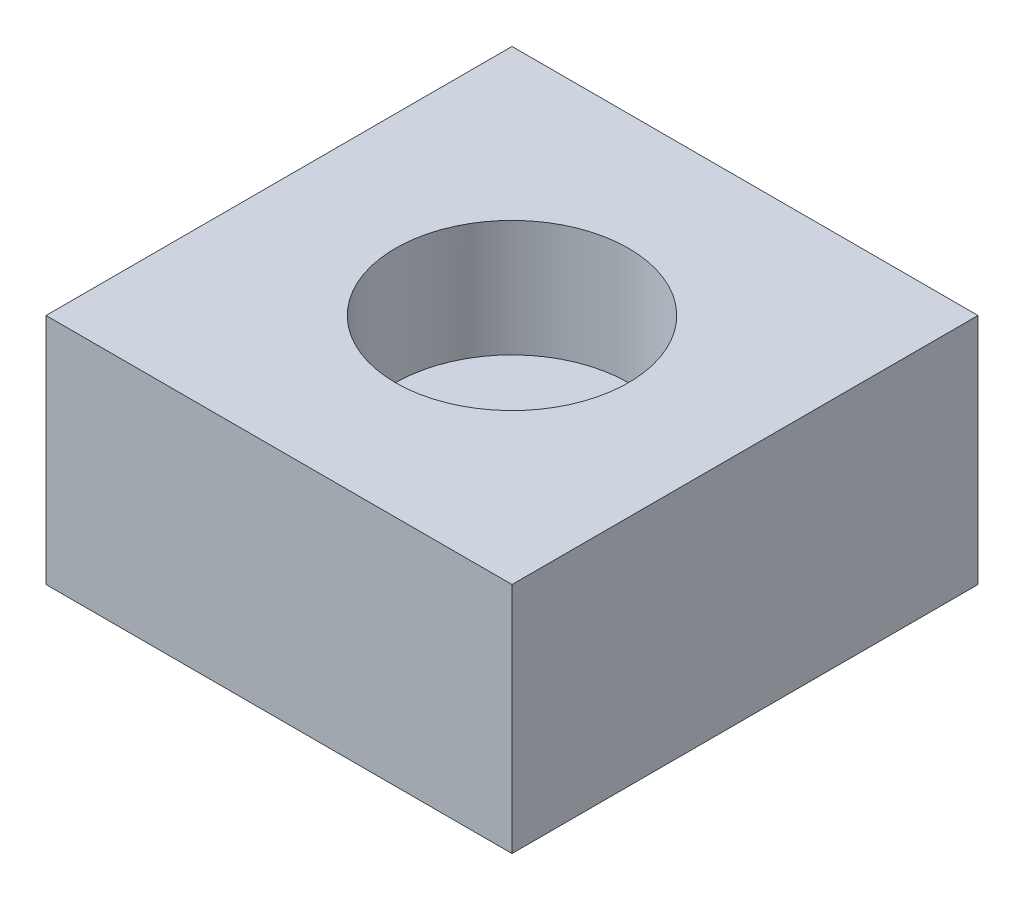
from build123d import *

# Parameters (mm, degrees)
SKETCH1_W           = 2000
SKETCH1_H           = 2000
SKETCH1_R           = 500
BOSS_EXTRUDE1_DEPTH = 1000
SKETCH2_R           = 500
BOSS_EXTRUDE2_DEPTH = 500


with BuildPart() as part:
    # Sketch1 → Boss-Extrude1 (new body)
    with BuildSketch(Plane(origin=(0, 0, 0), x_dir=(1, 0, 0), z_dir=(0, 1, 0))):
        Rectangle(SKETCH1_W, SKETCH1_H)
        Circle(SKETCH1_R, mode=Mode.SUBTRACT)
    extrude(amount=BOSS_EXTRUDE1_DEPTH)

    # Sketch2 → Boss-Extrude2 (add)
    with BuildSketch(Plane.XZ):
        Circle(SKETCH2_R)
    extrude(amount=-BOSS_EXTRUDE2_DEPTH)


solid = part.part
